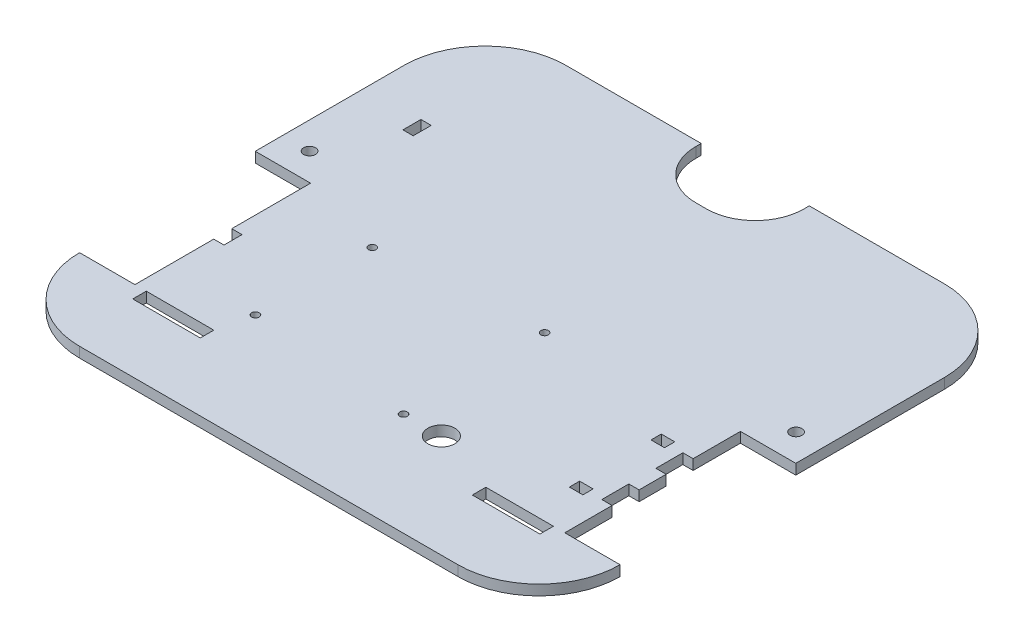
from build123d import *

# Parameters (mm, degrees)
SKETCH1_W           = 254
SKETCH1_H           = 228.6
BOSS_EXTRUDE1_DEPTH = 4.826
SKETCH2_W           = 26.00000007
SKETCH2_H           = 82.55
CUT_EXTRUDE1_DEPTH  = 4.826
CUT_EXTRUDE3_DEPTH  = 4.826
SKETCH7_W           = 50.8
SKETCH7_H           = 25.4
CUT_EXTRUDE5_DEPTH  = 4.826
FILLET9_R           = 22.86
FILLET10_R          = 22.86
CUT_EXTRUDE6_DEPTH  = 4.826
SKETCH9_W           = 31.75
SKETCH9_H           = 6.35
CUT_EXTRUDE7_DEPTH  = 171.929167423
SKETCH17_R          = 2.778125
CUT_EXTRUDE14_DEPTH = 171.929167423
SKETCH18_W          = 4.826
SKETCH18_H          = 12.7
CUT_EXTRUDE15_DEPTH = 171.929167423
SKETCH19_W          = 4.826
SKETCH19_H          = 8.466666666
CUT_EXTRUDE16_DEPTH = 171.929167423
SKETCH20_W          = 6.35
SKETCH20_H          = 4.826
CUT_EXTRUDE17_DEPTH = 4.826
SKETCH21_R          = 1.778
CUT_EXTRUDE18_DEPTH = 171.929167423
SKETCH22_R          = 6.35
CUT_EXTRUDE19_DEPTH = 171.929167423


with BuildPart() as part:
    # Sketch1 → Boss-Extrude1 (new body)
    with BuildSketch(Plane(origin=(0, 0, 0), x_dir=(1, 0, 0), z_dir=(0, 1, 0))):
        Rectangle(SKETCH1_W, SKETCH1_H)
    extrude(amount=BOSS_EXTRUDE1_DEPTH)

    # Sketch2 → Cut-Extrude1 (cut)
    with BuildSketch(Plane(origin=(0, 4.826, 0), x_dir=(1, 0, 0), z_dir=(0, 1, 0))):
        with Locations((-113.999999965, -34.925)):
            Rectangle(SKETCH2_W, SKETCH2_H)
        with Locations((113.999999965, -34.925)):
            Rectangle(SKETCH2_W, SKETCH2_H)
    extrude(amount=-CUT_EXTRUDE1_DEPTH, mode=Mode.SUBTRACT)

    # Sketch4 → Cut-Extrude3 (cut)
    with BuildSketch(Plane(origin=(0, 4.826, 0), x_dir=(1, 0, 0), z_dir=(0, 1, 0))):
        with BuildLine():
            Line((-127, 76.2), (-127, 114.3))
            Line((-127, 114.3), (-88.9, 114.3))
            ThreePointArc((-88.9, 114.3), (-115.840768363, 103.140768363), (-127, 76.2))
        make_face()
        with BuildLine():
            Line((127, 76.2), (127, 114.3))
            Line((127, 114.3), (88.9, 114.3))
            ThreePointArc((88.9, 114.3), (115.840768363, 103.140768363), (127, 76.2))
        make_face()
    extrude(amount=-CUT_EXTRUDE3_DEPTH, mode=Mode.SUBTRACT)

    # Sketch7 → Cut-Extrude5 (cut)
    with BuildSketch(Plane(origin=(0, 4.826, 0), x_dir=(1, 0, 0), z_dir=(0, 1, 0))):
        with Locations((0, 101.6)):
            Rectangle(SKETCH7_W, SKETCH7_H)
    extrude(amount=-CUT_EXTRUDE5_DEPTH, mode=Mode.SUBTRACT)

    # Fillet9
    fillet9_edges = [part.edges().sort_by_distance(p)[0] for p in [
        (-25.4, 2.413, -88.9),
    ]]
    fillet(fillet9_edges, radius=FILLET9_R)

    # Fillet10
    fillet10_edges = [part.edges().sort_by_distance(p)[0] for p in [
        (25.4, 2.413, -88.9),
    ]]
    fillet(fillet10_edges, radius=FILLET10_R)

    # Sketch8 → Cut-Extrude6 (cut)
    with BuildSketch(Plane(origin=(0, 4.826, 0), x_dir=(1, 0, 0), z_dir=(0, 1, 0))):
        with BuildLine():
            Line((-127, -76.2), (-127, -114.3))
            Line((-127, -114.3), (-88.9, -114.3))
            ThreePointArc((-88.9, -114.3), (-115.840768363, -103.140768363), (-127, -76.2))
        make_face()
        with BuildLine():
            Line((127, -114.3), (88.9, -114.3))
            ThreePointArc((88.9, -114.3), (115.840768363, -103.140768363), (127, -76.2))
            Line((127, -76.2), (127, -114.3))
        make_face()
    extrude(amount=-CUT_EXTRUDE6_DEPTH, mode=Mode.SUBTRACT)

    # Sketch9 → Cut-Extrude7 (cut, through all)
    with BuildSketch(Plane.XZ):
        with Locations((-79.79099993, 79.375)):
            Rectangle(SKETCH9_W, SKETCH9_H)
        with Locations((79.79099993, 79.375)):
            Rectangle(SKETCH9_W, SKETCH9_H)
    extrude(amount=-CUT_EXTRUDE7_DEPTH, mode=Mode.SUBTRACT)

    # Sketch17 → Cut-Extrude14 (cut, through all)
    with BuildSketch(Plane.XZ):
        with Locations((114.3, -19.164632523)):
            Circle(SKETCH17_R)
        with Locations((-114.3, -19.164632523)):
            Circle(SKETCH17_R)
    extrude(amount=-CUT_EXTRUDE14_DEPTH, mode=Mode.SUBTRACT)

    # Sketch18 → Cut-Extrude15 (cut, through all)
    with BuildSketch(Plane(origin=(0, 4.826, 0), x_dir=(1, 0, 0), z_dir=(0, 1, 0))):
        with Locations((98.58699993, -47.625)):
            Rectangle(SKETCH18_W, SKETCH18_H)
        with Locations((98.58699993, -22.225)):
            Rectangle(SKETCH18_W, SKETCH18_H)
    extrude(amount=-CUT_EXTRUDE15_DEPTH, mode=Mode.SUBTRACT)

    # Sketch19 → Cut-Extrude16 (cut, through all)
    with BuildSketch(Plane(origin=(0, 4.826, 0), x_dir=(1, 0, 0), z_dir=(0, 1, 0))):
        with Locations((-98.58699993, -34.925)):
            Rectangle(SKETCH19_W, SKETCH19_H)
        with Locations((-98.58699993, 53.975)):
            Rectangle(SKETCH19_W, SKETCH19_H)
    extrude(amount=-CUT_EXTRUDE16_DEPTH, mode=Mode.SUBTRACT)

    # Sketch20 → Cut-Extrude17 (cut)
    with BuildSketch(Plane.XZ):
        with Locations((86.64899993, 54.102)):
            Rectangle(SKETCH20_W, SKETCH20_H)
        with Locations((86.64899993, 15.748)):
            Rectangle(SKETCH20_W, SKETCH20_H)
    extrude(amount=-CUT_EXTRUDE17_DEPTH, mode=Mode.SUBTRACT)

    # Sketch21 → Cut-Extrude18 (cut, through all)
    with BuildSketch(Plane(origin=(0, 4.826, 0), x_dir=(1, 0, 0), z_dir=(0, 1, 0))):
        with Locations((-60.352188768, -60.219689657)):
            Circle(SKETCH21_R)
        with Locations((-60.352188768, -5.355689657)):
            Circle(SKETCH21_R)
        with Locations((14.831811232, -65.807689657)):
            Circle(SKETCH21_R)
        with Locations((14.831811232, 0.486310343)):
            Circle(SKETCH21_R)
    extrude(amount=-CUT_EXTRUDE18_DEPTH, mode=Mode.SUBTRACT)

    # Sketch22 → Cut-Extrude19 (cut, through all)
    with BuildSketch(Plane(origin=(0, 4.826, 0), x_dir=(1, 0, 0), z_dir=(0, 1, 0))):
        with Locations((32.611811232, -65.807689657)):
            Circle(SKETCH22_R)
    extrude(amount=-CUT_EXTRUDE19_DEPTH, mode=Mode.SUBTRACT)


solid = part.part
